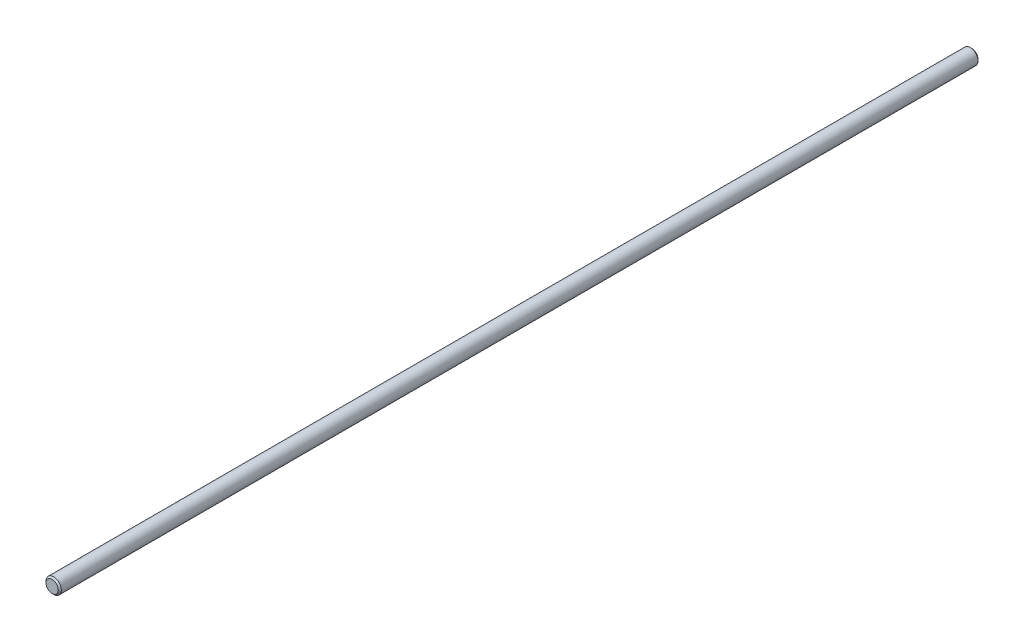
from build123d import *

# Parameters (mm, degrees)
SKETCH1_R           = 2.5
BOSS_EXTRUDE1_DEPTH = 300
CHAMFER1_SIZE       = 0.5


with BuildPart() as part:
    # Sketch1 → Boss-Extrude1 (new body)
    with BuildSketch(Plane.XY):
        Circle(SKETCH1_R)
    extrude(amount=-BOSS_EXTRUDE1_DEPTH)

    # Chamfer1
    chamfer1_edges = [part.edges().sort_by_distance(p)[0] for p in [
        (-2.5, 0, -300),
        (-2.5, 0, 0),
    ]]
    chamfer(chamfer1_edges, length=CHAMFER1_SIZE)


solid = part.part
